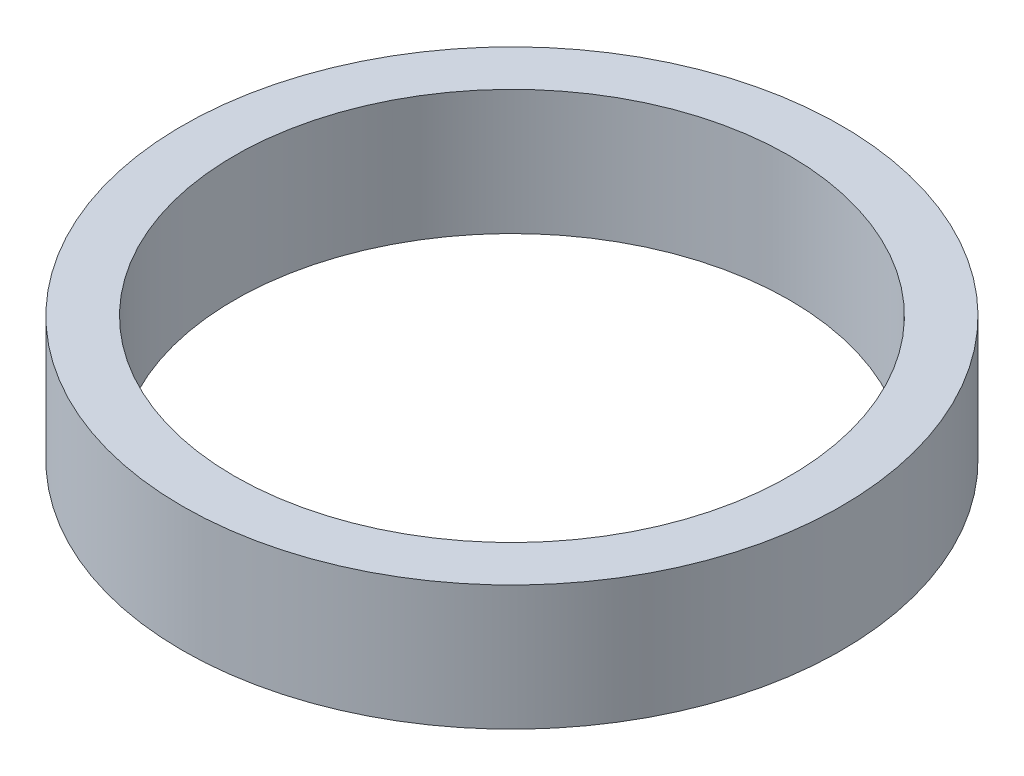
from build123d import *

# Parameters (mm, degrees)
SKETCH1_R           = 47.5
BOSS_EXTRUDE1_DEPTH = 18
SKETCH2_R           = 40
CUT_EXTRUDE1_DEPTH  = 70.544949493


with BuildPart() as part:
    # Sketch1 → Boss-Extrude1 (new body)
    with BuildSketch(Plane(origin=(0, 0, 0), x_dir=(1, 0, 0), z_dir=(0, 1, 0))):
        Circle(SKETCH1_R)
    extrude(amount=BOSS_EXTRUDE1_DEPTH)

    # Sketch2 → Cut-Extrude1 (cut, through all)
    with BuildSketch(Plane(origin=(0, 0, 0), x_dir=(1, 0, 0), z_dir=(0, 1, 0))):
        Circle(SKETCH2_R)
    extrude(amount=CUT_EXTRUDE1_DEPTH, mode=Mode.SUBTRACT)


solid = part.part
